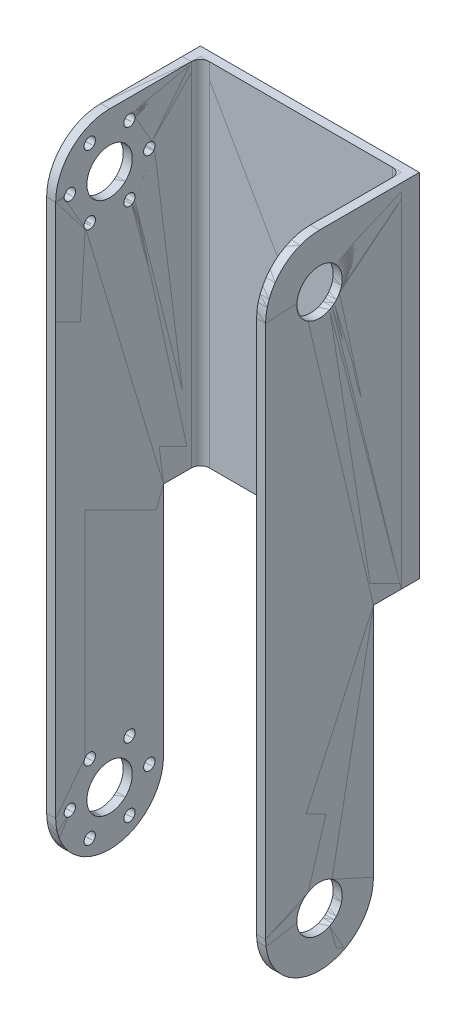
from build123d import *

# Parameters (mm, degrees)
ESQUISSE2_W                      = 35.4
ESQUISSE2_H                      = 62
BOSS_EXTRU_1_DEPTH               = 1.5875
ESQUISSE3_R                      = 4
BOSS_EXTRU_2_DEPTH               = 1.5875
CONG_4_R                         = 9.5
BOSS_EXTRU_3_START               = 1.5875
ESQUISSE4_R                      = 1
ESQUISSE4_R_2                    = 4
BOSS_EXTRU_3_DEPTH               = 1.5875
CONG_7_R                         = 9.5
CONVERTIR_VOLUME1_START          = -15.2125
CONVERTIR_VOLUME1_OUTLINE_W      = 62
CONVERTIR_VOLUME1_OUTLINE_H      = 1.5875
CONVERTIR_VOLUME1_DEPTH          = 32.225
CONVERTIR_VOLUME1_START_2        = 18.6
CONVERTIR_VOLUME1_2_OUTLINE_R    = 1
CONVERTIR_VOLUME1_2_DEPTH        = 1.5875
CONVERTIR_VOLUME1_START_3        = -18.3875
CONVERTIR_VOLUME1_3_DEPTH        = 1.5875
CONVERTIR_VOLUME1_START_4        = -65.437822174
CONVERTIR_VOLUME1_4_OUTLINE_W    = 1.5875
CONVERTIR_VOLUME1_4_OUTLINE_H    = 19
CONVERTIR_VOLUME1_4_DEPTH        = 79.815612528
CONVERTIR_VOLUME1_START_5        = -31
CONVERTIR_VOLUME1_5_DEPTH        = 62
CONVERTIR_VOLUME1_START_6        = -68.4999999
CONVERTIR_VOLUME1_6_OUTLINE_W    = 1.5875
CONVERTIR_VOLUME1_6_OUTLINE_H    = 19
CONVERTIR_VOLUME1_6_DEPTH        = 86.0499998
CONVERTIR_VOLUME1_START_7        = 16.377790454
CONVERTIR_VOLUME1_7_OUTLINE_W    = 1.5875
CONVERTIR_VOLUME1_7_OUTLINE_H    = 19
CONVERTIR_VOLUME1_7_DEPTH        = 1.062177727
CONVERTIR_VOLUME1_8_OUTLINE_W    = 1.5875
CONVERTIR_VOLUME1_8_OUTLINE_H    = 19
CONVERTIR_VOLUME1_8_DEPTH        = 1.062177626
CONVERTIR_VOLUME1_9_OUTLINE_R    = 1
CONVERTIR_VOLUME1_9_OUTLINE_R_2  = 4
CONVERTIR_VOLUME1_9_DEPTH        = 1.5875
CONVERTIR_VOLUME1_10_OUTLINE_R   = 1
CONVERTIR_VOLUME1_10_OUTLINE_R_2 = 4
CONVERTIR_VOLUME1_10_DEPTH       = 1.5875


with BuildPart() as part:
    # Esquisse2 → Boss.-Extru.1 (new body)
    with BuildSketch(Plane.XY):
        with Locations((0.9, 0)):
            Rectangle(ESQUISSE2_W, ESQUISSE2_H)
    extrude(amount=BOSS_EXTRU_1_DEPTH)

    # Esquisse3 → Boss.-Extru.2 (add)
    with BuildSketch(Plane(origin=(18.6, 0, 0), x_dir=(0, 0, -1), z_dir=(1, 0, 0))):
        with BuildLine():
            Line((0, 31), (-27.0875, 31))
            Line((-27.0875, 31), (-27.0875, -72.5))
            ThreePointArc((-27.0875, -72.5), (-17.5875, -82), (-8.0875, -72.5))
            Line((-8.0875, -72.5), (-8.0875, -31))
            Line((-8.0875, -31), (0, -31))
            Line((0, -31), (0, 31))
        make_face()
        with Locations((-17.5875, -72.5)):
            Circle(ESQUISSE3_R, mode=Mode.SUBTRACT)
        with Locations((-17.5875, 21.55)):
            Circle(ESQUISSE3_R, mode=Mode.SUBTRACT)
    extrude(amount=BOSS_EXTRU_2_DEPTH)

    # Congé4
    cong_4_edges = [part.edges().sort_by_distance(p)[0] for p in [
        (19.39375, 31, 27.0875),
    ]]
    fillet(cong_4_edges, radius=CONG_4_R)

    # Esquisse4 → Boss.-Extru.3 (add)
    with BuildSketch(Plane.ZY.offset(16.8).offset(BOSS_EXTRU_3_START)):
        with BuildLine():
            Line((27.0875, 31), (0, 31))
            Line((0, 31), (0, -31))
            Line((0, -31), (8.0875, -31))
            Line((8.0875, -31), (8.0875, -72.5))
            ThreePointArc((8.0875, -72.5), (17.5875, -82), (27.0875, -72.5))
            Line((27.0875, -72.5), (27.0875, 31))
        make_face()
        with Locations((10.5875, -72.5)):
            Circle(ESQUISSE4_R, mode=Mode.SUBTRACT)
        with Locations((14.0875, -78.562177826)):
            Circle(ESQUISSE4_R, mode=Mode.SUBTRACT)
        with Locations(Location((17.5875, -72.5, 0), (0, 0, 180))):
            Circle(ESQUISSE4_R_2, mode=Mode.SUBTRACT)
        with Locations((14.0875, -66.437822174)):
            Circle(ESQUISSE4_R, mode=Mode.SUBTRACT)
        with Locations((21.0875, -78.562177826)):
            Circle(ESQUISSE4_R, mode=Mode.SUBTRACT)
        with Locations((24.5875, -72.5)):
            Circle(ESQUISSE4_R, mode=Mode.SUBTRACT)
        with Locations((21.0875, -66.437822174)):
            Circle(ESQUISSE4_R, mode=Mode.SUBTRACT)
        with Locations((10.5875, 21.439968281)):
            Circle(ESQUISSE4_R, mode=Mode.SUBTRACT)
        with Locations((14.0875, 15.377790454)):
            Circle(ESQUISSE4_R, mode=Mode.SUBTRACT)
        with Locations((14.0875, 27.502146107)):
            Circle(ESQUISSE4_R, mode=Mode.SUBTRACT)
        with Locations((17.5875, 21.439968281)):
            Circle(ESQUISSE4_R_2, mode=Mode.SUBTRACT)
        with Locations((21.0875, 15.377790454)):
            Circle(ESQUISSE4_R, mode=Mode.SUBTRACT)
        with Locations((21.0875, 27.502146107)):
            Circle(ESQUISSE4_R, mode=Mode.SUBTRACT)
        with Locations((24.5875, 21.439968281)):
            Circle(ESQUISSE4_R, mode=Mode.SUBTRACT)
    extrude(amount=-BOSS_EXTRU_3_DEPTH)

    # Congé7
    cong_7_edges = [part.edges().sort_by_distance(p)[0] for p in [
        (-17.59375, 31, 27.0875),
    ]]
    fillet(cong_7_edges, radius=CONG_7_R)


with BuildPart() as body_2:
    # Convertir-Volume1: read off the stored shape, not the designer's step
    # Convertir-Volume1 outline → Convertir-Volume1 (new body)
    with BuildSketch(Plane.YZ.offset(CONVERTIR_VOLUME1_START)):
        with Locations((0, 0.79375)):
            Rectangle(CONVERTIR_VOLUME1_OUTLINE_W, CONVERTIR_VOLUME1_OUTLINE_H)
    extrude(amount=CONVERTIR_VOLUME1_DEPTH)

    # Convertir-Volume1 2 outline → Convertir-Volume1 2 (add)
    with BuildSketch(Plane.YZ.offset(CONVERTIR_VOLUME1_START_2)):
        with BuildLine():
            ThreePointArc((21.49498414, 13.587878361), (17.55, 17.5875), (21.49498414, 21.587121639))
            ThreePointArc((21.49498414, 21.587121639), (17.439968281, 17.5875), (21.49498414, 13.587878361))
        make_face()
        with Locations((15.377790454, 21.0875)):
            Circle(CONVERTIR_VOLUME1_2_OUTLINE_R)
        with Locations((21.439968281, 24.5875)):
            Circle(CONVERTIR_VOLUME1_2_OUTLINE_R)
        with Locations((27.502146107, 21.0875)):
            Circle(CONVERTIR_VOLUME1_2_OUTLINE_R)
        with Locations((27.502146107, 14.0875)):
            Circle(CONVERTIR_VOLUME1_2_OUTLINE_R)
        with Locations((21.439968281, 10.5875)):
            Circle(CONVERTIR_VOLUME1_2_OUTLINE_R)
        with Locations((15.377790454, 14.0875)):
            Circle(CONVERTIR_VOLUME1_2_OUTLINE_R)
        with Locations((-78.562177826, 21.0875)):
            Circle(CONVERTIR_VOLUME1_2_OUTLINE_R)
        with Locations((-72.5, 24.5875)):
            Circle(CONVERTIR_VOLUME1_2_OUTLINE_R)
        with Locations((-66.437822174, 21.0875)):
            Circle(CONVERTIR_VOLUME1_2_OUTLINE_R)
        with Locations((-66.437822174, 14.0875)):
            Circle(CONVERTIR_VOLUME1_2_OUTLINE_R)
        with Locations((-72.5, 10.5875)):
            Circle(CONVERTIR_VOLUME1_2_OUTLINE_R)
        with Locations((-78.562177826, 14.0875)):
            Circle(CONVERTIR_VOLUME1_2_OUTLINE_R)
    extrude(amount=CONVERTIR_VOLUME1_2_DEPTH)

    # Convertir-Volume1 3 outline → Convertir-Volume1 3 (add)
    with BuildSketch(Plane.YZ.offset(CONVERTIR_VOLUME1_START_3)):
        with BuildLine():
            ThreePointArc((21.49498414, 13.587878361), (25.55, 17.5875), (21.49498414, 21.587121639))
            ThreePointArc((21.49498414, 21.587121639), (25.439968281, 17.5875), (21.49498414, 13.587878361))
        make_face()
    extrude(amount=CONVERTIR_VOLUME1_3_DEPTH)

    # Convertir-Volume1 4 outline → Convertir-Volume1 4 (add)
    with BuildSketch(Plane(origin=(0, 0, 0), x_dir=(1, 0, 0), z_dir=(0, 1, 0)).offset(CONVERTIR_VOLUME1_START_4)):
        with Locations((19.39375, -17.5875)):
            Rectangle(CONVERTIR_VOLUME1_4_OUTLINE_W, CONVERTIR_VOLUME1_4_OUTLINE_H)
        with Locations((-17.59375, -17.5875)):
            Rectangle(CONVERTIR_VOLUME1_4_OUTLINE_W, CONVERTIR_VOLUME1_4_OUTLINE_H)
    extrude(amount=CONVERTIR_VOLUME1_4_DEPTH)

    # Convertir-Volume1 5 outline → Convertir-Volume1 5 (add)
    with BuildSketch(Plane(origin=(0, 0, 0), x_dir=(1, 0, 0), z_dir=(0, 1, 0)).offset(CONVERTIR_VOLUME1_START_5)):
        with BuildLine():
            Line((18.6, -8.0875), (20.1875, -8.0875))
            Line((20.1875, -8.0875), (20.1875, -3.175))
            ThreePointArc((20.1875, -3.175), (19.25756403, -0.92993597), (17.0125, 0))
            Line((17.0125, 0), (17.0125, -1.5875))
            ThreePointArc((17.0125, -1.5875), (18.135032015, -2.052467985), (18.6, -3.175))
            Line((18.6, -3.175), (18.6, -8.0875))
        make_face()
        with BuildLine():
            Line((-18.3875, -8.0875), (-16.8, -8.0875))
            Line((-16.8, -8.0875), (-16.8, -3.175))
            ThreePointArc((-16.8, -3.175), (-16.335032015, -2.052467985), (-15.2125, -1.5875))
            Line((-15.2125, -1.5875), (-15.2125, 0))
            ThreePointArc((-15.2125, 0), (-17.45756403, -0.92993597), (-18.3875, -3.175))
            Line((-18.3875, -3.175), (-18.3875, -8.0875))
        make_face()
    extrude(amount=CONVERTIR_VOLUME1_5_DEPTH)

    # Convertir-Volume1 6 outline → Convertir-Volume1 6 (add)
    with BuildSketch(Plane(origin=(0, 0, 0), x_dir=(1, 0, 0), z_dir=(0, 1, 0)).offset(CONVERTIR_VOLUME1_START_6)):
        with Locations((19.39375, -17.5875)):
            Rectangle(CONVERTIR_VOLUME1_6_OUTLINE_W, CONVERTIR_VOLUME1_6_OUTLINE_H)
    extrude(amount=CONVERTIR_VOLUME1_6_DEPTH)

    # Convertir-Volume1 7 outline → Convertir-Volume1 7 (add)
    with BuildSketch(Plane(origin=(0, 0, 0), x_dir=(1, 0, 0), z_dir=(0, 1, 0)).offset(CONVERTIR_VOLUME1_START_7)):
        with Locations((-17.59375, -17.5875)):
            Rectangle(CONVERTIR_VOLUME1_7_OUTLINE_W, CONVERTIR_VOLUME1_7_OUTLINE_H)
    extrude(amount=CONVERTIR_VOLUME1_7_DEPTH)

    # Convertir-Volume1 8 outline → Convertir-Volume1 8 (add)
    with BuildSketch(Plane(origin=(0, 0, 0), x_dir=(1, 0, 0), z_dir=(0, 1, 0)).offset(CONVERTIR_VOLUME1_START_6)):
        with Locations((-17.59375, -17.5875)):
            Rectangle(CONVERTIR_VOLUME1_8_OUTLINE_W, CONVERTIR_VOLUME1_8_OUTLINE_H)
    extrude(amount=CONVERTIR_VOLUME1_8_DEPTH)

    # Convertir-Volume1 9 outline → Convertir-Volume1 9 (add)
    with BuildSketch(Plane.YZ.offset(CONVERTIR_VOLUME1_START_3)):
        with BuildLine():
            Line((31, 3.175), (31, 17.5875))
            ThreePointArc((31, 17.5875), (28.217514421, 24.305014421), (21.5, 27.0875))
            Line((21.5, 27.0875), (-72.5, 27.0875))
            ThreePointArc((-72.5, 27.0875), (-82, 17.5875), (-72.5, 8.0875))
            Line((-72.5, 8.0875), (-31, 8.0875))
            Line((-31, 8.0875), (-31, 3.175))
            Line((-31, 3.175), (31, 3.175))
        make_face()
        with Locations((-72.5, 10.5875)):
            Circle(CONVERTIR_VOLUME1_9_OUTLINE_R, mode=Mode.SUBTRACT)
        with Locations((-78.562177826, 14.0875)):
            Circle(CONVERTIR_VOLUME1_9_OUTLINE_R, mode=Mode.SUBTRACT)
        with Locations((-66.437822174, 14.0875)):
            Circle(CONVERTIR_VOLUME1_9_OUTLINE_R, mode=Mode.SUBTRACT)
        with Locations((21.439968281, 10.5875)):
            Circle(CONVERTIR_VOLUME1_9_OUTLINE_R, mode=Mode.SUBTRACT)
        with Locations((15.377790454, 14.0875)):
            Circle(CONVERTIR_VOLUME1_9_OUTLINE_R, mode=Mode.SUBTRACT)
        with Locations((27.502146107, 14.0875)):
            Circle(CONVERTIR_VOLUME1_9_OUTLINE_R, mode=Mode.SUBTRACT)
        with Locations((-72.5, 17.5875)):
            Circle(CONVERTIR_VOLUME1_9_OUTLINE_R_2, mode=Mode.SUBTRACT)
        with Locations((-78.562177826, 21.0875)):
            Circle(CONVERTIR_VOLUME1_9_OUTLINE_R, mode=Mode.SUBTRACT)
        with Locations((-66.437822174, 21.0875)):
            Circle(CONVERTIR_VOLUME1_9_OUTLINE_R, mode=Mode.SUBTRACT)
        with Locations((-72.5, 24.5875)):
            Circle(CONVERTIR_VOLUME1_9_OUTLINE_R, mode=Mode.SUBTRACT)
        with BuildLine():
            ThreePointArc((21.49498414, 13.587878361), (17.439968281, 17.5875), (21.49498414, 21.587121639))
            ThreePointArc((21.49498414, 21.587121639), (25.55, 17.5875), (21.49498414, 13.587878361))
        make_face(mode=Mode.SUBTRACT)
        with Locations((15.377790454, 21.0875)):
            Circle(CONVERTIR_VOLUME1_9_OUTLINE_R, mode=Mode.SUBTRACT)
        with Locations((27.502146107, 21.0875)):
            Circle(CONVERTIR_VOLUME1_9_OUTLINE_R, mode=Mode.SUBTRACT)
        with Locations((21.439968281, 24.5875)):
            Circle(CONVERTIR_VOLUME1_9_OUTLINE_R, mode=Mode.SUBTRACT)
    extrude(amount=CONVERTIR_VOLUME1_9_DEPTH)

    # Convertir-Volume1 10 outline → Convertir-Volume1 10 (add)
    with BuildSketch(Plane.YZ.offset(CONVERTIR_VOLUME1_START_2)):
        with BuildLine():
            Line((31, 3.175), (31, 17.5875))
            ThreePointArc((31, 17.5875), (28.217514421, 24.305014421), (21.5, 27.0875))
            Line((21.5, 27.0875), (-72.5, 27.0875))
            ThreePointArc((-72.5, 27.0875), (-82, 17.5875), (-72.5, 8.0875))
            Line((-72.5, 8.0875), (-31, 8.0875))
            Line((-31, 8.0875), (-31, 3.175))
            Line((-31, 3.175), (31, 3.175))
        make_face()
        with Locations((-72.5, 10.5875)):
            Circle(CONVERTIR_VOLUME1_10_OUTLINE_R, mode=Mode.SUBTRACT)
        with Locations((-78.562177826, 14.0875)):
            Circle(CONVERTIR_VOLUME1_10_OUTLINE_R, mode=Mode.SUBTRACT)
        with Locations((-66.437822174, 14.0875)):
            Circle(CONVERTIR_VOLUME1_10_OUTLINE_R, mode=Mode.SUBTRACT)
        with Locations((21.439968281, 10.5875)):
            Circle(CONVERTIR_VOLUME1_10_OUTLINE_R, mode=Mode.SUBTRACT)
        with Locations((15.377790454, 14.0875)):
            Circle(CONVERTIR_VOLUME1_10_OUTLINE_R, mode=Mode.SUBTRACT)
        with Locations((27.502146107, 14.0875)):
            Circle(CONVERTIR_VOLUME1_10_OUTLINE_R, mode=Mode.SUBTRACT)
        with Locations((-72.5, 17.5875)):
            Circle(CONVERTIR_VOLUME1_10_OUTLINE_R_2, mode=Mode.SUBTRACT)
        with Locations((-78.562177826, 21.0875)):
            Circle(CONVERTIR_VOLUME1_10_OUTLINE_R, mode=Mode.SUBTRACT)
        with Locations((-66.437822174, 21.0875)):
            Circle(CONVERTIR_VOLUME1_10_OUTLINE_R, mode=Mode.SUBTRACT)
        with Locations((-72.5, 24.5875)):
            Circle(CONVERTIR_VOLUME1_10_OUTLINE_R, mode=Mode.SUBTRACT)
        with BuildLine():
            ThreePointArc((21.49498414, 13.587878361), (17.439968281, 17.5875), (21.49498414, 21.587121639))
            ThreePointArc((21.49498414, 21.587121639), (25.55, 17.5875), (21.49498414, 13.587878361))
        make_face(mode=Mode.SUBTRACT)
        with Locations((15.377790454, 21.0875)):
            Circle(CONVERTIR_VOLUME1_10_OUTLINE_R, mode=Mode.SUBTRACT)
        with Locations((27.502146107, 21.0875)):
            Circle(CONVERTIR_VOLUME1_10_OUTLINE_R, mode=Mode.SUBTRACT)
        with Locations((21.439968281, 24.5875)):
            Circle(CONVERTIR_VOLUME1_10_OUTLINE_R, mode=Mode.SUBTRACT)
    extrude(amount=CONVERTIR_VOLUME1_10_DEPTH)


solid = Compound([part.part, body_2.part])
